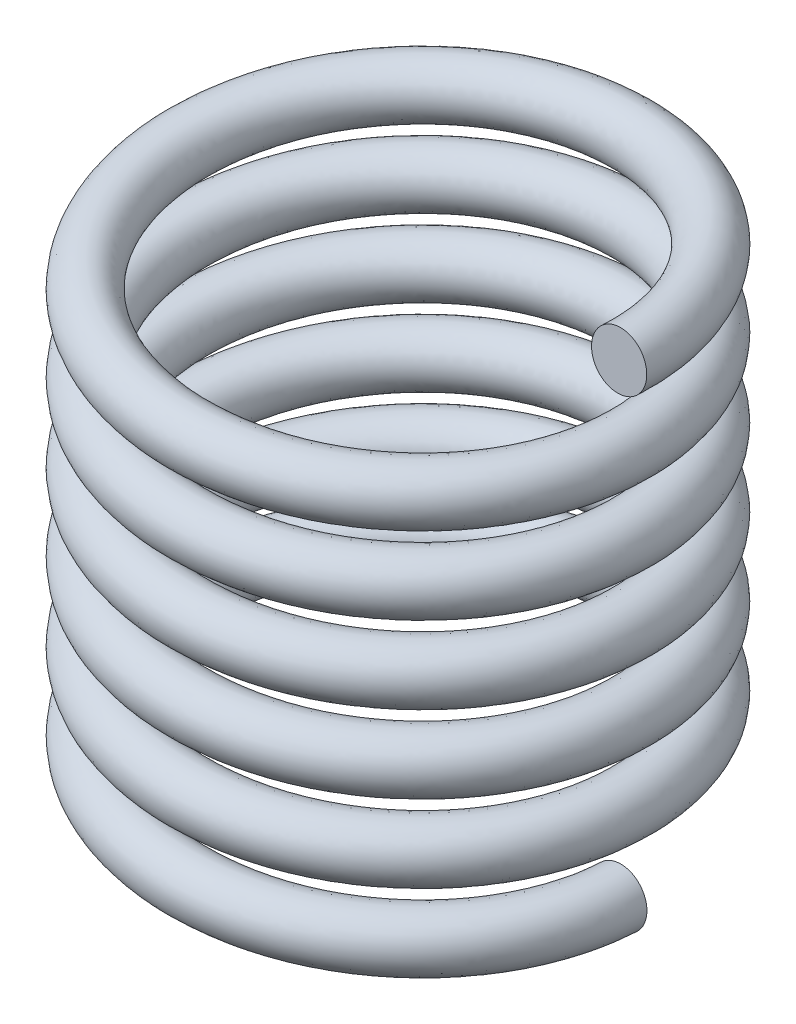
from build123d import *

# Parameters (mm, degrees)
SWEEP_1_PROFILE_R = 1.25


with BuildPart() as part:
    # 扫描1: sweep along a curve in space
    with BuildLine() as sweep_1_path:
        add(Edge.make_bspline(
            [(10, 0, 0), (10.005431626, 0.097222222, 1.746738729), (9.296042782, 0.243055556, 4.359284345), (7.152213602, 0.4375, 7.152279848), (5.057466975, 0.583333333, 8.759754257), (2.617918498, 0.729166667, 9.77022735), (1.741e-06, 0.875, 10.114885921), (-2.617925461, 1.020833333, 9.770228966), (-5.057442602, 1.166666667, 8.759747794), (-7.152304129, 1.3125, 7.152304087), (-8.759747751, 1.458333333, 5.05744273), (-9.770229093, 1.604166667, 2.617924994), (-10.114885454, 1.75, 0), (-9.770229091, 1.895833333, -2.617924995), (-8.75974776, 2.041666667, -5.057442727), (-7.152304096, 2.1875, -7.152304096), (-5.057442727, 2.333333333, -8.75974776), (-2.617924995, 2.479166667, -9.770229091), (0, 2.625, -10.114885455), (2.617924995, 2.770833333, -9.770229091), (5.057442727, 2.916666667, -8.75974776), (7.152304096, 3.0625, -7.152304096), (8.75974776, 3.208333333, -5.057442727), (9.770229091, 3.354166667, -2.617924995), (10.114885455, 3.5, 0), (9.770229091, 3.645833333, 2.617924995), (8.75974776, 3.791666667, 5.057442727), (7.152304096, 3.9375, 7.152304096), (5.057442727, 4.083333333, 8.75974776), (2.617924995, 4.229166667, 9.770229091), (0, 4.375, 10.114885455), (-2.617924995, 4.520833333, 9.770229091), (-5.057442727, 4.666666667, 8.75974776), (-7.152304096, 4.8125, 7.152304096), (-8.75974776, 4.958333333, 5.057442727), (-9.770229091, 5.104166667, 2.617924995), (-10.114885455, 5.25, 0), (-9.770229091, 5.395833333, -2.617924995), (-8.75974776, 5.541666667, -5.057442727), (-7.152304096, 5.6875, -7.152304096), (-5.057442727, 5.833333333, -8.75974776), (-2.617924995, 5.979166667, -9.770229091), (0, 6.125, -10.114885455), (2.617924995, 6.270833333, -9.770229091), (5.057442727, 6.416666667, -8.75974776), (7.152304096, 6.5625, -7.152304096), (8.75974776, 6.708333333, -5.057442727), (9.770229091, 6.854166667, -2.617924995), (10.114885455, 7, 0), (9.770229091, 7.145833333, 2.617924995), (8.75974776, 7.291666667, 5.057442727), (7.152304096, 7.4375, 7.152304096), (5.057442727, 7.583333333, 8.75974776), (2.617924995, 7.729166667, 9.770229091), (0, 7.875, 10.114885455), (-2.617924995, 8.020833333, 9.770229091), (-5.057442727, 8.166666667, 8.75974776), (-7.152304096, 8.3125, 7.152304096), (-8.75974776, 8.458333333, 5.057442727), (-9.770229091, 8.604166667, 2.617924995), (-10.114885455, 8.75, 0), (-9.770229091, 8.895833333, -2.617924995), (-8.75974776, 9.041666667, -5.057442727), (-7.152304096, 9.1875, -7.152304096), (-5.057442727, 9.333333333, -8.75974776), (-2.617924995, 9.479166667, -9.770229091), (0, 9.625, -10.114885455), (2.617924995, 9.770833333, -9.770229091), (5.057442727, 9.916666667, -8.75974776), (7.152304096, 10.0625, -7.152304096), (8.75974776, 10.208333333, -5.057442727), (9.770229091, 10.354166667, -2.617924995), (10.114885455, 10.5, 0), (9.770229091, 10.645833333, 2.617924995), (8.75974776, 10.791666667, 5.057442727), (7.152304096, 10.9375, 7.152304096), (5.057442727, 11.083333333, 8.75974776), (2.617924995, 11.229166667, 9.770229091), (0, 11.375, 10.114885455), (-2.617924995, 11.520833333, 9.770229091), (-5.057442727, 11.666666667, 8.75974776), (-7.152304096, 11.8125, 7.152304096), (-8.75974776, 11.958333333, 5.057442727), (-9.770229091, 12.104166667, 2.617924995), (-10.114885455, 12.25, 0), (-9.770229091, 12.395833333, -2.617924995), (-8.75974776, 12.541666667, -5.057442727), (-7.152304096, 12.6875, -7.152304096), (-5.057442727, 12.833333333, -8.75974776), (-2.617924995, 12.979166667, -9.770229091), (0, 13.125, -10.114885455), (2.617924995, 13.270833333, -9.770229091), (5.057442727, 13.416666667, -8.75974776), (7.152304096, 13.5625, -7.152304096), (8.75974776, 13.708333333, -5.057442727), (9.770229091, 13.854166667, -2.617924995), (10.114885455, 14, 0), (9.770229091, 14.145833333, 2.617924995), (8.75974776, 14.291666667, 5.057442727), (7.152304096, 14.4375, 7.152304096), (5.057442727, 14.583333333, 8.75974776), (2.617924995, 14.729166667, 9.770229091), (0, 14.875, 10.114885455), (-2.617924995, 15.020833333, 9.770229091), (-5.057442727, 15.166666667, 8.75974776), (-7.152304096, 15.3125, 7.152304096), (-8.75974776, 15.458333333, 5.057442727), (-9.770229091, 15.604166667, 2.617924995), (-10.114885455, 15.75, 0), (-9.770229091, 15.895833333, -2.617924995), (-8.75974776, 16.041666667, -5.057442727), (-7.152304096, 16.1875, -7.152304096), (-5.057442727, 16.333333333, -8.75974776), (-2.617924995, 16.479166667, -9.770229091), (0, 16.625, -10.114885455), (2.617924995, 16.770833333, -9.770229091), (5.057442727, 16.916666667, -8.75974776), (7.152304096, 17.0625, -7.152304096), (8.75974776, 17.208333333, -5.057442727), (9.770229091, 17.354166667, -2.617924995), (10.114885455, 17.5, 0), (9.770229091, 17.645833333, 2.617924995), (8.75974776, 17.791666667, 5.057442727), (7.152304096, 17.9375, 7.152304096), (5.057442727, 18.083333333, 8.75974776), (2.617924995, 18.229166667, 9.770229091), (0, 18.375, 10.114885455), (-2.617924995, 18.520833333, 9.770229091), (-5.057442727, 18.666666667, 8.75974776), (-7.152304096, 18.8125, 7.152304096), (-8.75974776, 18.958333333, 5.057442727), (-9.770229091, 19.104166667, 2.617924995), (-10.114885454, 19.25, 0), (-9.770229093, 19.395833333, -2.617924994), (-8.759747751, 19.541666667, -5.05744273), (-7.152304129, 19.6875, -7.152304087), (-5.057442602, 19.833333333, -8.759747794), (-2.617925461, 19.979166667, -9.770228966), (1.741e-06, 20.125, -10.114885921), (2.617918498, 20.270833333, -9.77022735), (5.057466975, 20.416666667, -8.759754257), (7.152213602, 20.5625, -7.152279848), (9.296042782, 20.756944444, -4.359284345), (10.005431626, 20.902777778, -1.746738729), (10, 21, 0)],
            knots=[0, 0, 0, 0, 0.013888889, 0.020833333, 0.027777778, 0.034722222, 0.041666667, 0.048611111, 0.055555556, 0.0625, 0.069444444, 0.076388889, 0.083333333, 0.090277778, 0.097222222, 0.104166667, 0.111111111, 0.118055556, 0.125, 0.131944444, 0.138888889, 0.145833333, 0.152777778, 0.159722222, 0.166666667, 0.173611111, 0.180555556, 0.1875, 0.194444444, 0.201388889, 0.208333333, 0.215277778, 0.222222222, 0.229166667, 0.236111111, 0.243055556, 0.25, 0.256944444, 0.263888889, 0.270833333, 0.277777778, 0.284722222, 0.291666667, 0.298611111, 0.305555556, 0.3125, 0.319444444, 0.326388889, 0.333333333, 0.340277778, 0.347222222, 0.354166667, 0.361111111, 0.368055556, 0.375, 0.381944444, 0.388888889, 0.395833333, 0.402777778, 0.409722222, 0.416666667, 0.423611111, 0.430555556, 0.4375, 0.444444444, 0.451388889, 0.458333333, 0.465277778, 0.472222222, 0.479166667, 0.486111111, 0.493055556, 0.5, 0.506944444, 0.513888889, 0.520833333, 0.527777778, 0.534722222, 0.541666667, 0.548611111, 0.555555556, 0.5625, 0.569444444, 0.576388889, 0.583333333, 0.590277778, 0.597222222, 0.604166667, 0.611111111, 0.618055556, 0.625, 0.631944444, 0.638888889, 0.645833333, 0.652777778, 0.659722222, 0.666666667, 0.673611111, 0.680555556, 0.6875, 0.694444444, 0.701388889, 0.708333333, 0.715277778, 0.722222222, 0.729166667, 0.736111111, 0.743055556, 0.75, 0.756944444, 0.763888889, 0.770833333, 0.777777778, 0.784722222, 0.791666667, 0.798611111, 0.805555556, 0.8125, 0.819444444, 0.826388889, 0.833333333, 0.840277778, 0.847222222, 0.854166667, 0.861111111, 0.868055556, 0.875, 0.881944444, 0.888888889, 0.895833333, 0.902777778, 0.909722222, 0.916666667, 0.923611111, 0.930555556, 0.9375, 0.944444444, 0.951388889, 0.958333333, 0.965277778, 0.972222222, 0.979166667, 0.986111111, 1, 1, 1, 1], degree=3))
    # 扫描1 profile (on start of the path) → 扫描1 (sweep)
    with BuildSketch(Plane(origin=(10, 0, 0), x_dir=(0, 0.9984546119372517, -0.05557326606590671), z_dir=(0.0031047604975445427, 0.05557299821496324, 0.9984497996051943))):
        Circle(SWEEP_1_PROFILE_R)
    sweep(path=sweep_1_path.line, is_frenet=True)


solid = part.part
